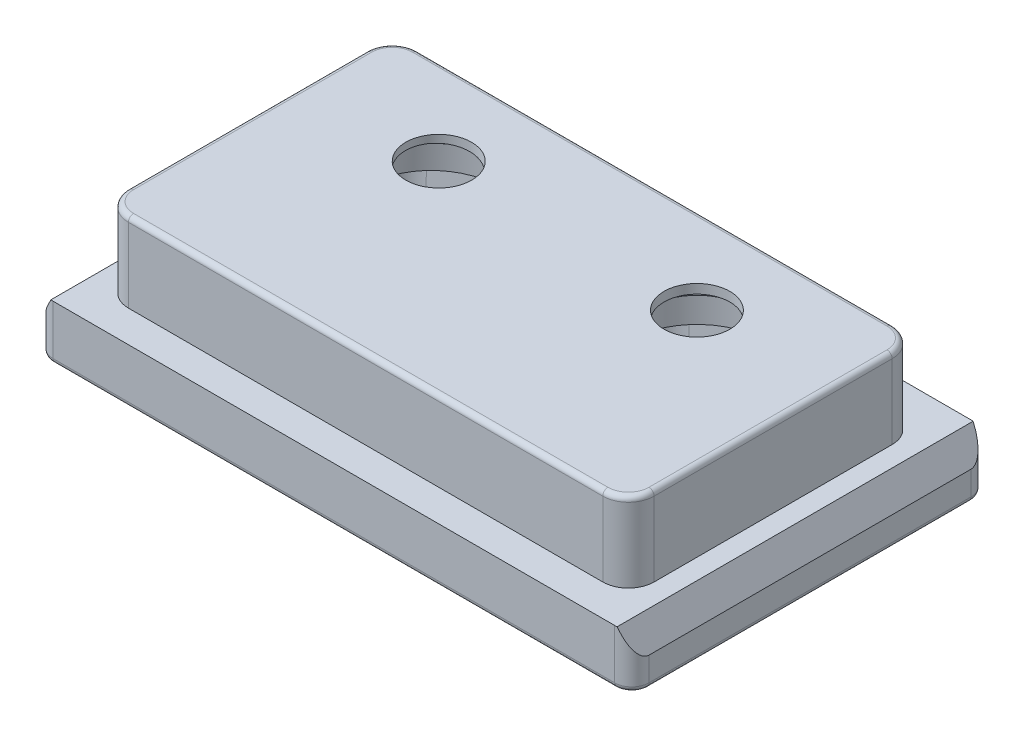
from build123d import *

# Parameters (mm, degrees)
BOSS_EXTRUDE1_DEPTH     = 8.128
FILLET1_R               = 0.762
CHAMFER1_SIZE           = 2.199704526
CHAMFER1_SIZE_2         = 3.81
BOSS_EXTRUDE2_DEPTH     = 11.7856
FILLET2_R               = 0.762
SKETCH3_W               = 1.524
SKETCH3_H               = 18.1356
BOSS_EXTRUDE3_DEPTH     = 6.35
CUT_EXTRUDE1_DEPTH      = 6.35
FILLET3_R               = 0.508
CUT_EXTRUDE2_DEPTH      = 3.048
FILLET4_R               = 0.254
SKETCH6_R               = 1.1303
CUT_EXTRUDE3_DEPTH      = 10.16
SKETCH7_R               = 4.8768
CUT_EXTRUDE4_DEPTH      = 56.205461115
CUT_EXTRUDE5_DEPTH      = 10.16
CUT_EXTRUDE5_DEPTH_BACK = 56.612084277
SKETCH8_R               = 4.8768
CUT_EXTRUDE6_DEPTH      = 10.16
SKETCH10_R              = 6.8326
CUT_EXTRUDE7_DEPTH      = 7.7724
SKETCH11_R              = 7.2517
CUT_EXTRUDE8_DEPTH      = 6.7818
SKETCH12_R              = 9.2329
CUT_EXTRUDE9_DEPTH      = 5.9436
SKETCH13_R              = 10.3632
CUT_EXTRUDE10_DEPTH     = 4.953
FILLET5_R               = 0.254
CUT_EXTRUDE11_START     = -7.7216
SKETCH14_R              = 4.8768
CUT_EXTRUDE11_DEPTH     = 7.7216
SKETCH15_R              = 6.8326
CUT_EXTRUDE12_DEPTH     = 7.7724
SKETCH16_R              = 7.2517
CUT_EXTRUDE13_DEPTH     = 6.7818
SKETCH17_R              = 9.2329
CUT_EXTRUDE14_DEPTH     = 5.9436
SKETCH18_R              = 10.3632
CUT_EXTRUDE15_DEPTH     = 4.953
FILLET6_R               = 0.254
CUT_EXTRUDE16_DEPTH     = 6.604
CUT_EXTRUDE17_DEPTH     = 6.604


with BuildPart() as part:
    # Sketch1 → Boss-Extrude1 (new body)
    with BuildSketch(Plane(origin=(0, 0, 0), x_dir=(1, 0, 0), z_dir=(0, 1, 0))):
        with BuildLine():
            Line((41.656, -26.416), (-41.656, -26.416))
            ThreePointArc((-41.656, -26.416), (-43.452051224, -25.672051224), (-44.196, -23.876))
            Line((-44.196, -23.876), (-44.196, 23.876))
            ThreePointArc((-44.196, 23.876), (-43.452051224, 25.672051224), (-41.656, 26.416))
            Line((-41.656, 26.416), (41.656, 26.416))
            ThreePointArc((41.656, 26.416), (43.452051224, 25.672051224), (44.196, 23.876))
            Line((44.196, 23.876), (44.196, -23.876))
            ThreePointArc((44.196, -23.876), (43.452051224, -25.672051224), (41.656, -26.416))
        make_face()
    extrude(amount=BOSS_EXTRUDE1_DEPTH)

    # Fillet1
    fillet1_edges = [part.edges().sort_by_distance(p)[0] for p in [
        (0, 0, 26.416),
        (-43.452051224, 0, 25.672051224),
        (-44.196, 0, 0),
        (-43.452051224, 0, -25.672051224),
        (0, 0, -26.416),
        (43.452051224, 0, -25.672051224),
        (44.196, 0, 0),
        (43.452051224, 0, 25.672051224),
    ]]
    fillet(fillet1_edges, radius=FILLET1_R)

    # Chamfer1
    # the kernel refuses this chamfer: 3.81, 2.199704526 mm, written as the material it takes off along each edge
    with BuildSketch(Plane(origin=(44.196, 8.128, -33.732796725), x_dir=(-0.9983227437537926, 0.057893862402670415, 0), z_dir=(0, 0, 1)), Plane(origin=(-44.196, 8.128, 33.732796725), x_dir=(0.9983227437537926, 0.057893862402670415, 0), z_dir=(0, 0, -1))) as chamfer1_piece_1:
        Polygon((CHAMFER1_SIZE * 0.998322743578, CHAMFER1_SIZE * 0.0578938623925), (-CHAMFER1_SIZE_2 * 0.0578938624027, CHAMFER1_SIZE_2 * 0.998322743754), (0, 0), align=None)
    extrude(amount=67.46559345, mode=Mode.SUBTRACT)

    # Sketch2 → Boss-Extrude2 (add)
    with BuildSketch(Plane(origin=(0, 8.128, 0), x_dir=(1, 0, 0), z_dir=(0, 1, 0))):
        with BuildLine():
            Line((-35.179, 21.209), (35.179, 21.209))
            ThreePointArc((35.179, 21.209), (37.873076836, 20.093076836), (38.989, 17.399))
            Line((38.989, 17.399), (38.989, -17.907))
            ThreePointArc((38.989, -17.907), (37.873076836, -20.601076836), (35.179, -21.717))
            Line((35.179, -21.717), (-35.179, -21.717))
            ThreePointArc((-35.179, -21.717), (-37.873076836, -20.601076836), (-38.989, -17.907))
            Line((-38.989, -17.907), (-38.989, 17.399))
            ThreePointArc((-38.989, 17.399), (-37.873076836, 20.093076836), (-35.179, 21.209))
        make_face()
    extrude(amount=BOSS_EXTRUDE2_DEPTH)

    # Fillet2
    fillet2_edges = [part.edges().sort_by_distance(p)[0] for p in [
        (37.873076836, 19.9136, -20.093076836),
        (0, 19.9136, -21.209),
        (-37.873076836, 19.9136, -20.093076836),
        (-38.989, 19.9136, 0.254),
        (-37.873076836, 19.9136, 20.601076836),
        (0, 19.9136, 21.717),
        (37.873076836, 19.9136, 20.601076836),
        (38.989, 19.9136, 0.254),
    ]]
    fillet(fillet2_edges, radius=FILLET2_R)

    # Sketch3 → Boss-Extrude3 (add)
    with BuildSketch(Plane(origin=(0, 8.128, 0), x_dir=(1, 0, 0), z_dir=(0, 1, 0))):
        with Locations((-39.751, -0.508)):
            Rectangle(SKETCH3_W, SKETCH3_H)
    extrude(amount=BOSS_EXTRUDE3_DEPTH)

    # Sketch4 → Cut-Extrude1 (cut)
    with BuildSketch(Plane(origin=(0, 14.478, 0), x_dir=(1, 0, 0), z_dir=(0, 1, 0))):
        with BuildLine():
            Line((-40.513, -9.5758), (-38.989, -9.5758))
            ThreePointArc((-38.989, -9.5758), (-39.397783031, -8.062010334), (-40.513, -6.959760894))
            Line((-40.513, -6.959760894), (-40.513, -9.5758))
        make_face()
        with BuildLine():
            Line((-40.513, 8.5598), (-40.513, 5.943760894))
            ThreePointArc((-40.513, 5.943760894), (-39.397783031, 7.046010334), (-38.989, 8.5598))
            Line((-38.989, 8.5598), (-40.513, 8.5598))
        make_face()
    extrude(amount=-CUT_EXTRUDE1_DEPTH, mode=Mode.SUBTRACT)

    # Fillet3
    fillet3_edges = [part.edges().sort_by_distance(p)[0] for p in [
        (-40.513, 11.303, 6.959760894),
        (-40.513, 11.303, -5.943760894),
    ]]
    fillet(fillet3_edges, radius=FILLET3_R)

    # Sketch5 → Cut-Extrude2 (cut)
    with BuildSketch(Plane.XZ):
        with BuildLine():
            Line((-32.385, -23.749), (32.385, -23.749))
            ThreePointArc((32.385, -23.749), (38.671179285, -21.145179285), (41.275, -14.859))
            Line((41.275, -14.859), (41.275, 14.859))
            ThreePointArc((41.275, 14.859), (38.671179285, 21.145179285), (32.385, 23.749))
            Line((32.385, 23.749), (-32.385, 23.749))
            ThreePointArc((-32.385, 23.749), (-38.671179285, 21.145179285), (-41.275, 14.859))
            Line((-41.275, 14.859), (-41.275, -14.859))
            ThreePointArc((-41.275, -14.859), (-38.671179285, -21.145179285), (-32.385, -23.749))
        make_face()
    extrude(amount=-CUT_EXTRUDE2_DEPTH, mode=Mode.SUBTRACT)

    # Fillet4
    fillet4_edges = [part.edges().sort_by_distance(p)[0] for p in [
        (38.671179285, 0, 21.145179285),
        (0, 0, 23.749),
        (-38.671179285, 0, 21.145179285),
        (-41.275, 0, 0),
        (-38.671179285, 0, -21.145179285),
        (0, 0, -23.749),
        (38.671179285, 0, -21.145179285),
        (41.275, 0, 0),
    ]]
    fillet(fillet4_edges, radius=FILLET4_R)

    # Sketch6 → Cut-Extrude3 (cut)
    with BuildSketch(Plane.XZ.offset(-3.048)):
        with Locations(Location((0, -18.161, 0), (0, 0, 270))):
            Circle(SKETCH6_R)
        with Locations(Location((0, 18.161, 0), (0, 0, 270))):
            Circle(SKETCH6_R)
        with Locations(Location((-35.687, 2.159, 0), (0, 0, 270))):
            Circle(SKETCH6_R)
        with Locations(Location((35.687, 2.159, 0), (0, 0, 270))):
            Circle(SKETCH6_R)
    extrude(amount=-CUT_EXTRUDE3_DEPTH, mode=Mode.SUBTRACT)

    # Sketch7 → Cut-Extrude4 (cut, through all)
    with BuildSketch(Plane(origin=(0, 19.9136, 0), x_dir=(1, 0, 0), z_dir=(0, 1, 0))):
        with Locations(Location((19.05, 8.382, 0), (0, 0, 270))):
            Circle(SKETCH7_R)
    extrude(amount=-CUT_EXTRUDE4_DEPTH, mode=Mode.SUBTRACT)

    # Sketch8 → Cut-Extrude5 (cut, two sides: drawn at the far end of the back side and taken through both)
    with BuildSketch(Plane(origin=(0.941308834, 18.908257796, 0), x_dir=(0, 0, -1), z_dir=(0.049721373868654384, 0.9987631275635948, 0)).offset(-CUT_EXTRUDE5_DEPTH_BACK)):
        with Locations(Location((8.382, 20.219517798, 0), (0, 0, 90))):
            Circle(SKETCH8_R)
    extrude(amount=CUT_EXTRUDE5_DEPTH + CUT_EXTRUDE5_DEPTH_BACK, mode=Mode.SUBTRACT)

    # Sketch9 → Cut-Extrude6 (cut)
    with BuildSketch(Plane(origin=(0.487919514, 9.800936341, 0), x_dir=(0, 0, -1), z_dir=(0.049721373868654384, 0.9987631275635948, 0))):
        with BuildLine():
            Line((3.555838686, 5.404887141), (-8.768854307, 12.520551959))
            ThreePointArc((-8.768854307, 12.520551959), (-13.213854307, 20.219517798), (-8.768854307, 27.918483638))
            Line((-8.768854307, 27.918483638), (3.555838686, 35.034148455))
            ThreePointArc((3.555838686, 35.034148455), (4.321588218, 35.351332297), (5.143338686, 35.459517798))
            Line((5.143338686, 35.459517798), (16.129, 35.459517798))
            ThreePointArc((16.129, 35.459517798), (18.37406403, 34.529581829), (19.304, 32.284517798))
            Line((19.304, 32.284517798), (19.304, 8.154517798))
            ThreePointArc((19.304, 8.154517798), (18.37406403, 5.909453768), (16.129, 4.979517798))
            Line((16.129, 4.979517798), (5.143338686, 4.979517798))
            ThreePointArc((5.143338686, 4.979517798), (4.321588218, 5.0877033), (3.555838686, 5.404887141))
        make_face()
    extrude(amount=-CUT_EXTRUDE6_DEPTH, mode=Mode.SUBTRACT)

    # Sketch10 → Cut-Extrude7 (cut)
    with BuildSketch(Plane(origin=(0.487919514, 9.800936341, 0), x_dir=(0.9987631275635948, -0.04972137386865438, 0), z_dir=(-0.04972137386865438, -0.9987631275635948, 0))):
        with Locations((-20.219517798, -8.382)):
            Circle(SKETCH10_R)
    extrude(amount=-CUT_EXTRUDE7_DEPTH, mode=Mode.SUBTRACT)

    # Sketch11 → Cut-Extrude8 (cut)
    with BuildSketch(Plane(origin=(0.487919514, 9.800936341, 0), x_dir=(0.9987631275635948, -0.04972137386865438, 0), z_dir=(-0.04972137386865438, -0.9987631275635948, 0))):
        with Locations((-20.219517798, -8.382)):
            Circle(SKETCH11_R)
    extrude(amount=-CUT_EXTRUDE8_DEPTH, mode=Mode.SUBTRACT)

    # Sketch12 → Cut-Extrude9 (cut)
    with BuildSketch(Plane(origin=(0.487919514, 9.800936341, 0), x_dir=(0.9987631275635948, -0.04972137386865438, 0), z_dir=(-0.04972137386865438, -0.9987631275635948, 0))):
        with Locations((-20.219517798, -8.382)):
            Circle(SKETCH12_R)
    extrude(amount=-CUT_EXTRUDE9_DEPTH, mode=Mode.SUBTRACT)

    # Sketch13 → Cut-Extrude10 (cut)
    with BuildSketch(Plane(origin=(0.487919514, 9.800936341, 0), x_dir=(0.9987631275635948, -0.04972137386865438, 0), z_dir=(-0.04972137386865438, -0.9987631275635948, 0))):
        with Locations((-20.219517798, -8.382)):
            Circle(SKETCH13_R)
    extrude(amount=-CUT_EXTRUDE10_DEPTH, mode=Mode.SUBTRACT)

    # Fillet5
    fillet5_edges = [part.edges().sort_by_distance(p)[0] for p in [
        (-26.144283859, 18.908791337, -8.382),
        (-28.632545443, 17.201599543, -8.382),
    ]]
    fillet(fillet5_edges, radius=FILLET5_R)

    # Sketch14 → Cut-Extrude11 (cut)
    with BuildSketch(Plane.XZ.offset(-3.048).offset(CUT_EXTRUDE11_START)):
        with BuildLine():
            ThreePointArc((3.81, -16.129), (4.73993597, -18.37406403), (6.985, -19.304))
            Line((6.985, -19.304), (31.115, -19.304))
            ThreePointArc((31.115, -19.304), (33.36006403, -18.37406403), (34.29, -16.129))
            Line((34.29, -16.129), (34.29, -5.132260733))
            ThreePointArc((34.29, -5.132260733), (34.184475661, -4.320506974), (33.874917061, -3.562712131))
            Line((33.874917061, -3.562712131), (26.777767772, 8.917018272))
            ThreePointArc((26.777767772, 8.917018272), (19.05, 13.412282186), (11.322232228, 8.917018272))
            Line((11.322232228, 8.917018272), (4.225082939, -3.562712131))
            ThreePointArc((4.225082939, -3.562712131), (3.915524339, -4.320506974), (3.81, -5.132260733))
            Line((3.81, -5.132260733), (3.81, -16.129))
        make_face()
        with Locations(Location((19.05, -8.382, 0), (0, 0, 90))):
            Circle(SKETCH14_R, mode=Mode.SUBTRACT)
    extrude(amount=CUT_EXTRUDE11_DEPTH, mode=Mode.SUBTRACT)

    # Sketch15 → Cut-Extrude12 (cut)
    with BuildSketch(Plane.XZ.offset(-10.7696)):
        with Locations(Location((19.05, -8.382, 0), (0, 0, 270))):
            Circle(SKETCH15_R)
    extrude(amount=-CUT_EXTRUDE12_DEPTH, mode=Mode.SUBTRACT)

    # Sketch16 → Cut-Extrude13 (cut)
    with BuildSketch(Plane.XZ.offset(-10.7696)):
        with Locations(Location((19.05, -8.382, 0), (0, 0, 270))):
            Circle(SKETCH16_R)
    extrude(amount=-CUT_EXTRUDE13_DEPTH, mode=Mode.SUBTRACT)

    # Sketch17 → Cut-Extrude14 (cut)
    with BuildSketch(Plane.XZ.offset(-10.7696)):
        with Locations(Location((19.05, -8.382, 0), (0, 0, 270))):
            Circle(SKETCH17_R)
    extrude(amount=-CUT_EXTRUDE14_DEPTH, mode=Mode.SUBTRACT)

    # Sketch18 → Cut-Extrude15 (cut)
    with BuildSketch(Plane.XZ.offset(-10.7696)):
        with Locations(Location((19.05, -8.382, 0), (0, 0, 270))):
            Circle(SKETCH18_R)
    extrude(amount=-CUT_EXTRUDE15_DEPTH, mode=Mode.SUBTRACT)

    # Fillet6
    fillet6_edges = [part.edges().sort_by_distance(p)[0] for p in [
        (19.05, 18.542, -1.5494),
        (19.05, 16.7132, 0.8509),
    ]]
    fillet(fillet6_edges, radius=FILLET6_R)

    # Sketch19 → Cut-Extrude16 (cut)
    with BuildSketch(Plane(origin=(0.487919514, 9.800936341, 0), x_dir=(0.9987631275635948, -0.04972137386865438, 0), z_dir=(-0.04972137386865438, -0.9987631275635948, 0))):
        with BuildLine():
            ThreePointArc((-29.718040426, -14.732), (-29.919002321, -13.982), (-30.468040426, -13.432961894))
            Line((-30.468040426, -13.432961894), (-31.218040426, -14.732))
            Line((-31.218040426, -14.732), (-29.718040426, -14.732))
        make_face()
        with BuildLine():
            Line((-31.218040426, -14.732), (-30.468040426, -13.432961894))
            ThreePointArc((-30.468040426, -13.432961894), (-32.517078532, -15.482), (-29.718040426, -14.732))
            Line((-29.718040426, -14.732), (-31.218040426, -14.732))
        make_face()
        with BuildLine():
            ThreePointArc((-7.72099517, -14.732), (-8.47099517, -13.432961894), (-9.97099517, -13.432961894))
            Line((-9.97099517, -13.432961894), (-9.22099517, -14.732))
            Line((-9.22099517, -14.732), (-10.72099517, -14.732))
            ThreePointArc((-10.72099517, -14.732), (-9.22099517, -16.232), (-7.72099517, -14.732))
        make_face()
        with BuildLine():
            Line((-9.22099517, -14.732), (-9.97099517, -13.432961894))
            ThreePointArc((-9.97099517, -13.432961894), (-10.520033276, -13.982), (-10.72099517, -14.732))
            Line((-10.72099517, -14.732), (-9.22099517, -14.732))
        make_face()
        with BuildLine():
            Line((-19.469517798, 3.018961894), (-20.219517798, 4.318))
            Line((-20.219517798, 4.318), (-20.969517798, 3.018961894))
            ThreePointArc((-20.969517798, 3.018961894), (-20.219517798, 2.818), (-19.469517798, 3.018961894))
        make_face()
        with BuildLine():
            Line((-20.969517798, 3.018961894), (-20.219517798, 4.318))
            Line((-20.219517798, 4.318), (-19.469517798, 3.018961894))
            ThreePointArc((-19.469517798, 3.018961894), (-18.920479693, 3.568), (-18.719517798, 4.318))
            ThreePointArc((-18.719517798, 4.318), (-20.969517798, 5.617038106), (-20.969517798, 3.018961894))
        make_face()
    extrude(amount=-CUT_EXTRUDE16_DEPTH, mode=Mode.SUBTRACT)

    # Sketch20 → Cut-Extrude17 (cut)
    with BuildSketch(Plane.XZ.offset(-10.7696)):
        with BuildLine():
            ThreePointArc((9.551477372, -14.732), (9.350515478, -13.982), (8.801477372, -13.432961894))
            Line((8.801477372, -13.432961894), (8.051477372, -14.732))
            Line((8.051477372, -14.732), (9.551477372, -14.732))
        make_face()
        with BuildLine():
            Line((8.051477372, -14.732), (8.801477372, -13.432961894))
            ThreePointArc((8.801477372, -13.432961894), (6.752439266, -15.482), (9.551477372, -14.732))
            Line((9.551477372, -14.732), (8.051477372, -14.732))
        make_face()
        with BuildLine():
            Line((19.8, 3.018961894), (19.05, 4.318))
            Line((19.05, 4.318), (18.3, 3.018961894))
            ThreePointArc((18.3, 3.018961894), (19.05, 2.818), (19.8, 3.018961894))
        make_face()
        with BuildLine():
            Line((18.3, 3.018961894), (19.05, 4.318))
            Line((19.05, 4.318), (19.8, 3.018961894))
            ThreePointArc((19.8, 3.018961894), (20.349038106, 3.568), (20.55, 4.318))
            ThreePointArc((20.55, 4.318), (18.3, 5.617038106), (18.3, 3.018961894))
        make_face()
        with BuildLine():
            ThreePointArc((31.548522628, -14.732), (30.798522628, -13.432961894), (29.298522628, -13.432961894))
            Line((29.298522628, -13.432961894), (30.048522628, -14.732))
            Line((30.048522628, -14.732), (28.548522628, -14.732))
            ThreePointArc((28.548522628, -14.732), (30.048522628, -16.232), (31.548522628, -14.732))
        make_face()
        with BuildLine():
            Line((30.048522628, -14.732), (29.298522628, -13.432961894))
            ThreePointArc((29.298522628, -13.432961894), (28.749484522, -13.982), (28.548522628, -14.732))
            Line((28.548522628, -14.732), (30.048522628, -14.732))
        make_face()
    extrude(amount=-CUT_EXTRUDE17_DEPTH, mode=Mode.SUBTRACT)


solid = part.part
